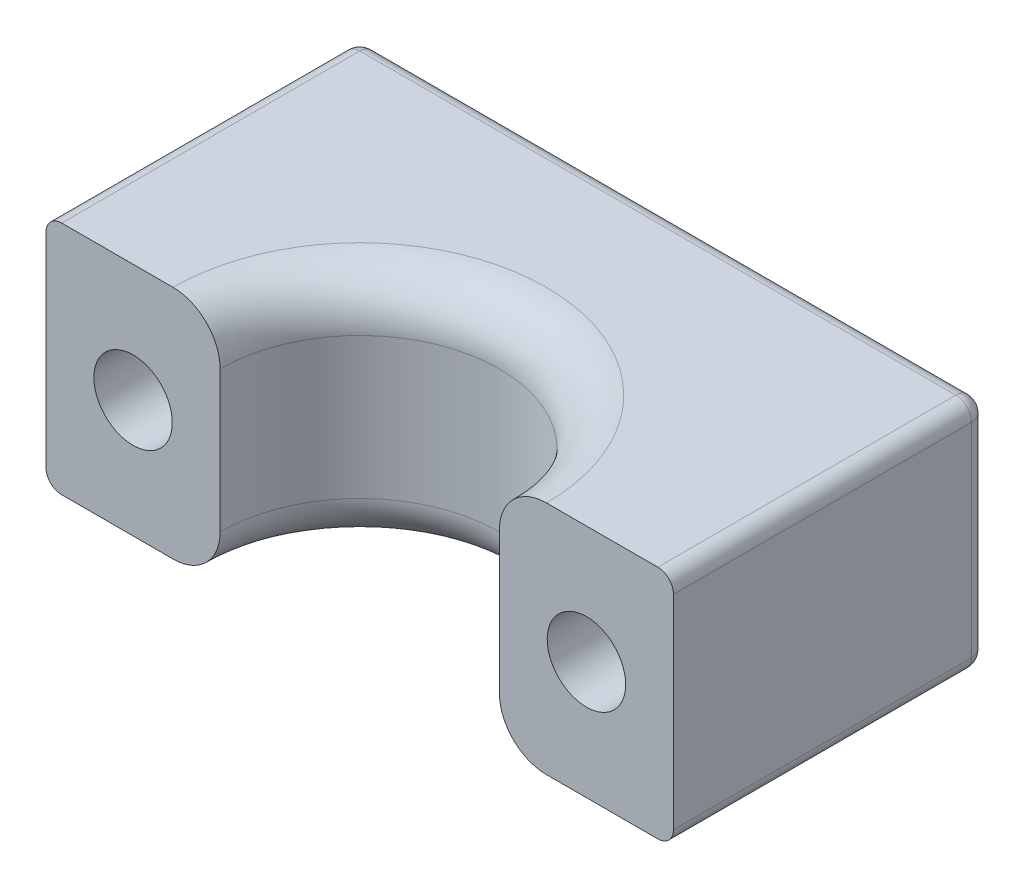
from build123d import *

# Parameters (mm, degrees)
SKETCH_1_W          = 40
SKETCH_1_H          = 40
EXTRUDE_1_DEPTH     = 15
SKETCH_3_R          = 8.9
CUT_EXTRUDE_1_DEPTH = 59.523499554
SKETCH_5_R          = 2.5
CUT_EXTRUDE_2_DEPTH = 59.523499554
SKETCH_6_W          = 40
SKETCH_6_H          = 20
CUT_EXTRUDE_3_DEPTH = 59.523499554
FILLET_1_R          = 3
FILLET_2_R          = 1
FILLET_3_R          = 1
FILLET_4_R          = 1


with BuildPart() as part:
    # 草圖1 → 填料-伸長1 (new body)
    with BuildSketch(Plane(origin=(0, 0, 0), x_dir=(1, 0, 0), z_dir=(0, 1, 0))):
        with Locations((20, 20)):
            Rectangle(SKETCH_1_W, SKETCH_1_H)
    extrude(amount=EXTRUDE_1_DEPTH)

    # 草圖3 → 除料-伸長1 (cut, through all)
    with BuildSketch(Plane(origin=(0, 15, 0), x_dir=(1, 0, 0), z_dir=(0, 1, 0))):
        with Locations(Location((20, 20, 0), (0, 0, 270))):
            Circle(SKETCH_3_R)
    extrude(amount=-CUT_EXTRUDE_1_DEPTH, mode=Mode.SUBTRACT)

    # 草圖5 → 除料-伸長2 (cut, through all)
    with BuildSketch(Plane.XY):
        with Locations((34.45, 7.5)):
            Circle(SKETCH_5_R)
        with Locations(Location((5.55, 7.5, 0), (0, 0, 180))):
            Circle(SKETCH_5_R)
    extrude(amount=-CUT_EXTRUDE_2_DEPTH, mode=Mode.SUBTRACT)

    # 草圖6 → 除料-伸長3 (cut, through all)
    with BuildSketch(Plane(origin=(0, 15, 0), x_dir=(1, 0, 0), z_dir=(0, 1, 0))):
        with Locations((20, 10)):
            Rectangle(SKETCH_6_W, SKETCH_6_H)
    extrude(amount=-CUT_EXTRUDE_3_DEPTH, mode=Mode.SUBTRACT)

    # 圓角1
    fillet_1_edges = [part.edges().sort_by_distance(p)[0] for p in [
        (20, 0, -28.9),
        (20, 15, -28.9),
    ]]
    fillet(fillet_1_edges, radius=FILLET_1_R)

    # 圓角2
    fillet_2_edges = [part.edges().sort_by_distance(p)[0] for p in [
        (20, 15, -40),
        (40, 15, -30),
        (0, 15, -30),
    ]]
    fillet(fillet_2_edges, radius=FILLET_2_R)

    # 圓角3
    # the kernel refuses this fillet: 1 mm, written as the material it takes off along each edge
    with BuildSketch(Plane(origin=(39, 14, -39), x_dir=(0, 0, -1), z_dir=(1, 0, 0))) as fillet_3_piece_1_section:
        Polygon((0, 0), (FILLET_3_R, 0), (FILLET_3_R, FILLET_3_R), (0, FILLET_3_R), align=None)
    fillet_3_piece_1 = extrude(amount=FILLET_3_R, mode=Mode.PRIVATE)
    fillet_3_piece_1 = fillet_3_piece_1 - Plane(origin=(39, 14, -39), x_dir=(0, -0.7071067811865475, 0.7071067811865475), z_dir=(1, 0, 0)) * Sphere(FILLET_3_R, mode=Mode.PRIVATE)
    add(fillet_3_piece_1, mode=Mode.SUBTRACT)
    with BuildSketch(Plane(origin=(1, 14, -39), x_dir=(-1, 0, 0), z_dir=(0, 0, -1))) as fillet_3_piece_2_section:
        Polygon((0, 0), (FILLET_3_R, 0), (FILLET_3_R, FILLET_3_R), (0, FILLET_3_R), align=None)
    fillet_3_piece_2 = extrude(amount=FILLET_3_R, mode=Mode.PRIVATE)
    fillet_3_piece_2 = fillet_3_piece_2 - Plane(origin=(1, 14, -39), x_dir=(0.7071067811865475, -0.7071067811865475, 0), z_dir=(0, 0, -1)) * Sphere(FILLET_3_R, mode=Mode.PRIVATE)
    add(fillet_3_piece_2, mode=Mode.SUBTRACT)
    with BuildSketch(Plane(origin=(0, -2.5, -40), x_dir=(1, 0, 0), z_dir=(0, 1, 0)), Plane(origin=(40, -2.5, -40), x_dir=(0, 0, 1), z_dir=(0, 1, 0))) as fillet_3_piece_3:
        with BuildLine():
            CenterArc((FILLET_3_R, -FILLET_3_R), FILLET_3_R, 90, 90)
            Line((0, -FILLET_3_R), (0, 0))
            Line((0, 0), (FILLET_3_R, 0))
        make_face()
    extrude(amount=16.5, mode=Mode.SUBTRACT)

    # 圓角4
    fillet_4_edges = [part.edges().sort_by_distance(p)[0] for p in [
        (40, 0, -29.5),
        (20, 0, -40),
        (0, 0, -29.5),
        (0.292893219, 0, -39.707106781),
        (39.707106781, 0, -39.707106781),
    ]]
    fillet(fillet_4_edges, radius=FILLET_4_R)


solid = part.part
